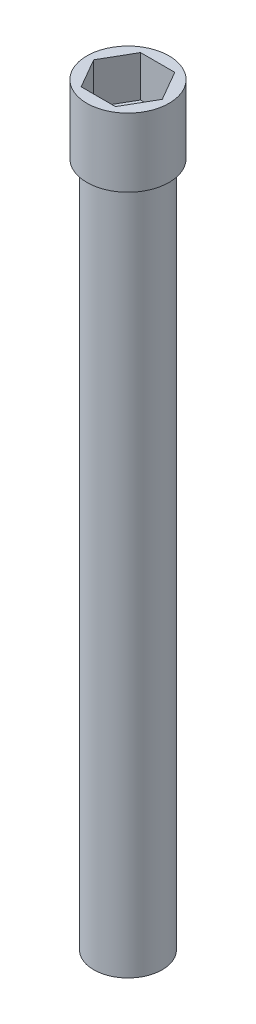
from build123d import *

# Parameters (mm, degrees)
SKETCH1_R           = 12.5
BOSS_EXTRUDE1_DEPTH = 250
SKETCH2_R           = 15
BOSS_EXTRUDE2_DEPTH = 25
CUT_EXTRUDE1_DEPTH  = 15


with BuildPart() as part:
    # Sketch1 → Boss-Extrude1 (new body)
    with BuildSketch(Plane(origin=(0, 0, 0), x_dir=(1, 0, 0), z_dir=(0, 1, 0))):
        Circle(SKETCH1_R)
    extrude(amount=BOSS_EXTRUDE1_DEPTH)

    # Sketch2 → Boss-Extrude2 (add)
    with BuildSketch(Plane(origin=(0, 250, 0), x_dir=(1, 0, 0), z_dir=(0, 1, 0))):
        Circle(SKETCH2_R)
    extrude(amount=BOSS_EXTRUDE2_DEPTH)

    # Sketch3 → Cut-Extrude1 (cut)
    with BuildSketch(Plane(origin=(0, 275, 0), x_dir=(1, 0, 0), z_dir=(0, 1, 0))):
        Polygon((-12.5, 0), (-6.25, -10.825317547), (6.25, -10.825317547), (12.5, 0), (6.25, 10.825317547), (-6.25, 10.825317547), align=None)
    extrude(amount=-CUT_EXTRUDE1_DEPTH, mode=Mode.SUBTRACT)


solid = part.part
